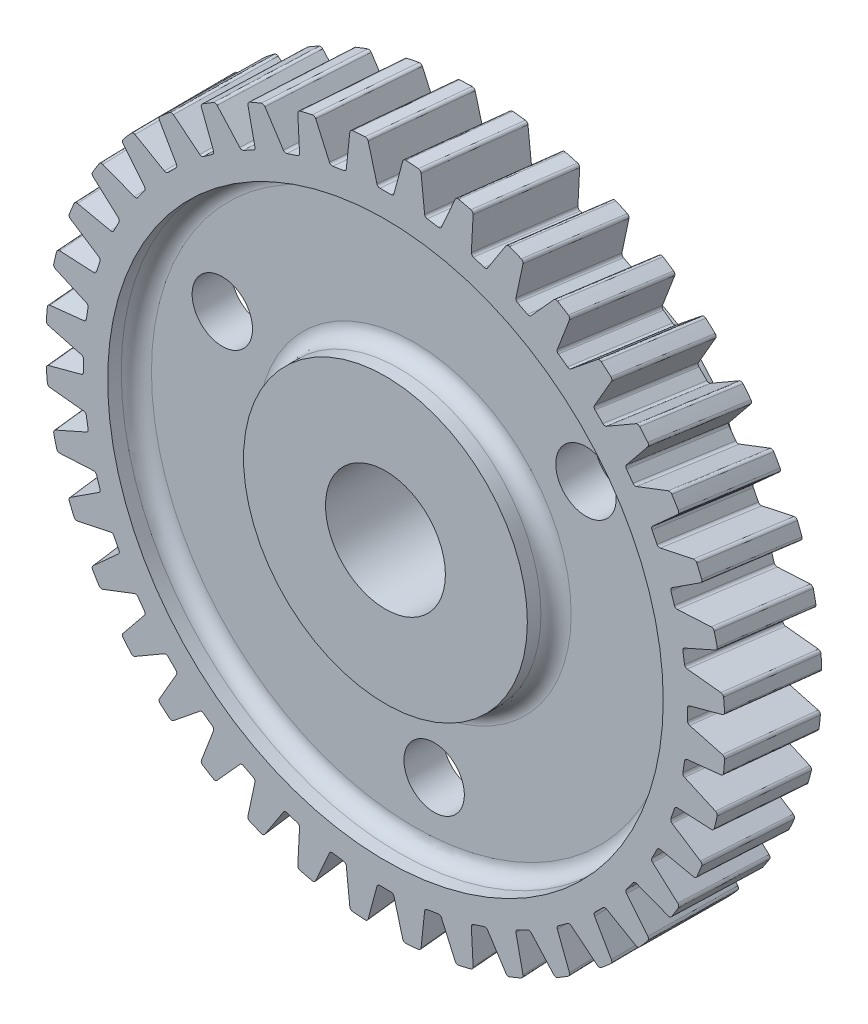
from build123d import *

# Parameters (mm, degrees)
FILLET1_R                = 1
CIRPATTERN1_COUNT        = 40
FILLET2_R                = 0.2
F_4_0_4_DIAMETER_HOLE1_D = 4


with BuildPart() as part:
    # Sketch2 → Revolve1 (revolve)
    with BuildSketch(Plane(origin=(0, 0, 0), x_dir=(0, 0, -1), z_dir=(1, 0, 0))):
        Polygon((11, 3.96875), (-3.2, 3.96875), (-3.2, 9.4), (-1.3, 9.4), (-1.3, 18.4), (-3.2, 18.4), (-3.2, 22.5), (3.2, 22.5), (3.2, 18.4), (1.3, 18.4), (1.3, 9.4), (3.2, 9.4), (11, 9.4), align=None)
    revolve(axis=Axis((0, 0, 0), (0, 0, -1)))

    # Fillet1
    fillet1_edges = [part.edges().sort_by_distance(p)[0] for p in [
        (0, -18.4, 1.3),
        (0, -9.4, 1.3),
        (0, -9.4, -1.3),
        (0, -18.4, -1.3),
    ]]
    fillet(fillet1_edges, radius=FILLET1_R)

    # Cut-Sweep1: sweep along a path in Sketch4
    with BuildLine(Plane(origin=(0, 0, 0), x_dir=(1, 0, 0), z_dir=(0, 1, 0))) as cut_sweep1_path:
        Line((0, -3.2), (0.690971205, 3.2))
    # Sketch3 → Cut-Sweep1 (sweep, cut)
    with BuildSketch(Plane.XY.offset(3.2)):
        Polygon((-0.525, 20), (0.525, 20), (1.246362285, 22.6921607), (-1.246362285, 22.6921607), align=None)
    cut_sweep1 = sweep(path=cut_sweep1_path.line, mode=Mode.SUBTRACT)

    # CirPattern1: Cut-Sweep1 ×40 about axis
    cirpattern1_axis = Axis((0, 0, 3.2), (0, 0, 1))
    for i in range(1, CIRPATTERN1_COUNT):
        add(cut_sweep1.rotate(cirpattern1_axis, i * 360 / CIRPATTERN1_COUNT), mode=Mode.SUBTRACT)

    # Fillet2
    fillet2_edges = [part.edges().sort_by_distance(p)[0] for p in [
        (1.526462518, 22.448160552, 5.3054e-05),
        (0.870485603, 20, 0),
        (-0.845126217, 22.484122435, -6.2808e-05),
        (-2.003996756, 22.410577793, 5.3054e-05),
        (-2.26892082, 19.889940761, 0),
        (-3.305993578, 19.725684573, 0),
        (-4.352012976, 22.07509871, -6.2808e-05),
        (-5.485110979, 21.821172231, 5.3054e-05),
        (-5.352458883, 19.29012517, 0),
        (-6.351068225, 18.965657326, 0),
        (-7.751738732, 21.122512792, -6.2808e-05),
        (-8.831163565, 20.694456989, 5.3054e-05),
        (-8.304201644, 18.215322678, 0),
        (-9.239758494, 17.738632653, 0),
        (-10.960590953, 19.649820507, -6.2808e-05),
        (-11.959763596, 19.058175535, 5.3054e-05),
        (-11.0514674, 16.691998487, 0),
        (-11.900935244, 16.074823972, 0),
        (-13.89955705, 17.693284427, -6.2808e-05),
        (-14.793874554, 16.952618549, 5.3054e-05),
        (-13.526609351, 14.757661896, 0),
        (-14.269071471, 14.015199776, 0),
        (-16.496269922, 15.301080964, -6.2808e-05),
        (-17.263711223, 14.429631832, 5.3054e-05),
        (-15.668681288, 12.459942692, 0),
        (-16.285855803, 11.610474848, 0),
        (-18.68678988, 12.532114106, -6.2808e-05),
        (-19.308458027, 11.55133969, 5.3054e-05),
        (-17.42493829, 9.855418346, 0),
        (-17.901628315, 8.919861496, 0),
        (-20.417179054, 9.454565008, -6.2808e-05),
        (-20.877766513, 8.388615227, 5.3054e-05),
        (-18.752135481, 7.008220892, 0),
        (-19.076603325, 6.00961155, 0),
        (-21.644829518, 6.144213141, -6.2808e-05),
        (-21.932995098, 5.019335218, 5.3054e-05),
        (-19.617592862, 3.988457781, 0),
        (-19.781849051, 2.951385024, 0),
        (-22.339512445, 2.682570354, -6.2808e-05),
        (-22.448160552, 1.526462518, 5.3054e-05),
        (-20, 0.870485603, 0),
        (-20, -0.179514397, 0),
        (-22.484122435, -0.845126217, -6.2808e-05),
        (-22.410577793, -2.003996756, 5.3054e-05),
        (-19.889940761, -2.26892082, 0),
        (-19.725684573, -3.305993578, 0),
        (-22.07509871, -4.352012976, -6.2808e-05),
        (-21.821172231, -5.485110979, 5.3054e-05),
        (-19.29012517, -5.352458883, 0),
        (-18.965657326, -6.351068225, 0),
        (-21.122512792, -7.751738732, -6.2808e-05),
        (-20.694456989, -8.831163565, 5.3054e-05),
        (-18.215322678, -8.304201644, 0),
        (-17.738632653, -9.239758494, 0),
        (-19.649820507, -10.960590953, -6.2808e-05),
        (-19.058175535, -11.959763596, 5.3054e-05),
        (-16.691998487, -11.0514674, 0),
        (-16.074823972, -11.900935244, 0),
        (-17.693284427, -13.89955705, -6.2808e-05),
        (-16.952618549, -14.793874554, 5.3054e-05),
        (-14.757661896, -13.526609351, 0),
        (-14.015199776, -14.269071471, 0),
        (-15.301080964, -16.496269922, -6.2808e-05),
        (-14.429631832, -17.263711223, 5.3054e-05),
        (-12.459942692, -15.668681288, 0),
        (-11.610474848, -16.285855803, 0),
        (-12.532114106, -18.68678988, -6.2808e-05),
        (-11.55133969, -19.308458027, 5.3054e-05),
        (-9.855418346, -17.42493829, 0),
        (-8.919861496, -17.901628315, 0),
        (-9.454565008, -20.417179054, -6.2808e-05),
        (-8.388615227, -20.877766513, 5.3054e-05),
        (-7.008220892, -18.752135481, 0),
        (-6.00961155, -19.076603325, 0),
        (-6.144213141, -21.644829518, -6.2808e-05),
        (-5.019335218, -21.932995098, 5.3054e-05),
        (-3.988457781, -19.617592862, 0),
        (-2.951385024, -19.781849051, 0),
        (-2.682570354, -22.339512445, -6.2808e-05),
        (-1.526462518, -22.448160552, 5.3054e-05),
        (-0.870485603, -20, 0),
        (0.179514397, -20, 0),
        (0.845126217, -22.484122435, -6.2808e-05),
        (2.003996756, -22.410577793, 5.3054e-05),
        (2.26892082, -19.889940761, 0),
        (3.305993578, -19.725684573, 0),
        (4.352012976, -22.07509871, -6.2808e-05),
        (5.485110979, -21.821172231, 5.3054e-05),
        (5.352458883, -19.29012517, 0),
        (6.351068225, -18.965657326, 0),
        (7.751738732, -21.122512792, -6.2808e-05),
        (8.831163565, -20.694456989, 5.3054e-05),
        (8.304201644, -18.215322678, 0),
        (9.239758494, -17.738632653, 0),
        (10.960590953, -19.649820507, -6.2808e-05),
        (11.959763596, -19.058175535, 5.3054e-05),
        (11.0514674, -16.691998487, 0),
        (11.900935244, -16.074823972, 0),
        (13.89955705, -17.693284427, -6.2808e-05),
        (14.793874554, -16.952618549, 5.3054e-05),
        (13.526609351, -14.757661896, 0),
        (14.269071471, -14.015199776, 0),
        (16.496269922, -15.301080964, -6.2808e-05),
        (17.263711223, -14.429631832, 5.3054e-05),
        (15.668681288, -12.459942692, 0),
        (16.285855803, -11.610474848, 0),
        (18.68678988, -12.532114106, -6.2808e-05),
        (19.308458027, -11.55133969, 5.3054e-05),
        (17.42493829, -9.855418346, 0),
        (17.901628315, -8.919861496, 0),
        (20.417179054, -9.454565008, -6.2808e-05),
        (20.877766513, -8.388615227, 5.3054e-05),
        (18.752135481, -7.008220892, 0),
        (19.076603325, -6.00961155, 0),
        (21.644829518, -6.144213141, -6.2808e-05),
        (21.932995098, -5.019335218, 5.3054e-05),
        (19.617592862, -3.988457781, 0),
        (19.781849051, -2.951385024, 0),
        (22.339512445, -2.682570354, -6.2808e-05),
        (22.448160552, -1.526462518, 5.3054e-05),
        (20, -0.870485603, 0),
        (20, 0.179514397, 0),
        (22.484122435, 0.845126217, -6.2808e-05),
        (22.410577793, 2.003996756, 5.3054e-05),
        (19.889940761, 2.26892082, 0),
        (19.725684573, 3.305993578, 0),
        (22.07509871, 4.352012976, -6.2808e-05),
        (21.821172231, 5.485110979, 5.3054e-05),
        (19.29012517, 5.352458883, 0),
        (18.965657326, 6.351068225, 0),
        (21.122512792, 7.751738732, -6.2808e-05),
        (20.694456989, 8.831163565, 5.3054e-05),
        (18.215322678, 8.304201644, 0),
        (17.738632653, 9.239758494, 0),
        (19.649820507, 10.960590953, -6.2808e-05),
        (19.058175535, 11.959763596, 5.3054e-05),
        (16.691998487, 11.0514674, 0),
        (16.074823972, 11.900935244, 0),
        (17.693284427, 13.89955705, -6.2808e-05),
        (16.952618549, 14.793874554, 5.3054e-05),
        (14.757661896, 13.526609351, 0),
        (14.015199776, 14.269071471, 0),
        (15.301080964, 16.496269922, -6.2808e-05),
        (14.429631832, 17.263711223, 5.3054e-05),
        (12.459942692, 15.668681288, 0),
        (11.610474848, 16.285855803, 0),
        (12.532114106, 18.68678988, -6.2808e-05),
        (11.55133969, 19.308458027, 5.3054e-05),
        (9.855418346, 17.42493829, 0),
        (8.919861496, 17.901628315, 0),
        (9.454565008, 20.417179054, -6.2808e-05),
        (8.388615227, 20.877766513, 5.3054e-05),
        (7.008220892, 18.752135481, 0),
        (6.00961155, 19.076603325, 0),
        (6.144213141, 21.644829518, -6.2808e-05),
        (5.019335218, 21.932995098, 5.3054e-05),
        (3.988457781, 19.617592862, 0),
        (2.951385024, 19.781849051, 0),
        (2.682570354, 22.339512445, -6.2808e-05),
        (-0.179514397, 20, 0),
    ]]
    fillet(fillet2_edges, radius=FILLET2_R)

    # Ø4.0 (4) Diameter Hole1 (through all)
    with Locations(Plane(origin=(59.759048418, -178.20301315, 3.9366), x_dir=(0.9999854958897523, -0.005385908477352911, 0), z_dir=(0, 0, 1))):
        with Locations((-73.454863948, 183.614199593), (-49.382318749, 186.041234273), (-59.31671766, 163.980281258)):
            Hole(F_4_0_4_DIAMETER_HOLE1_D / 2)


solid = part.part
